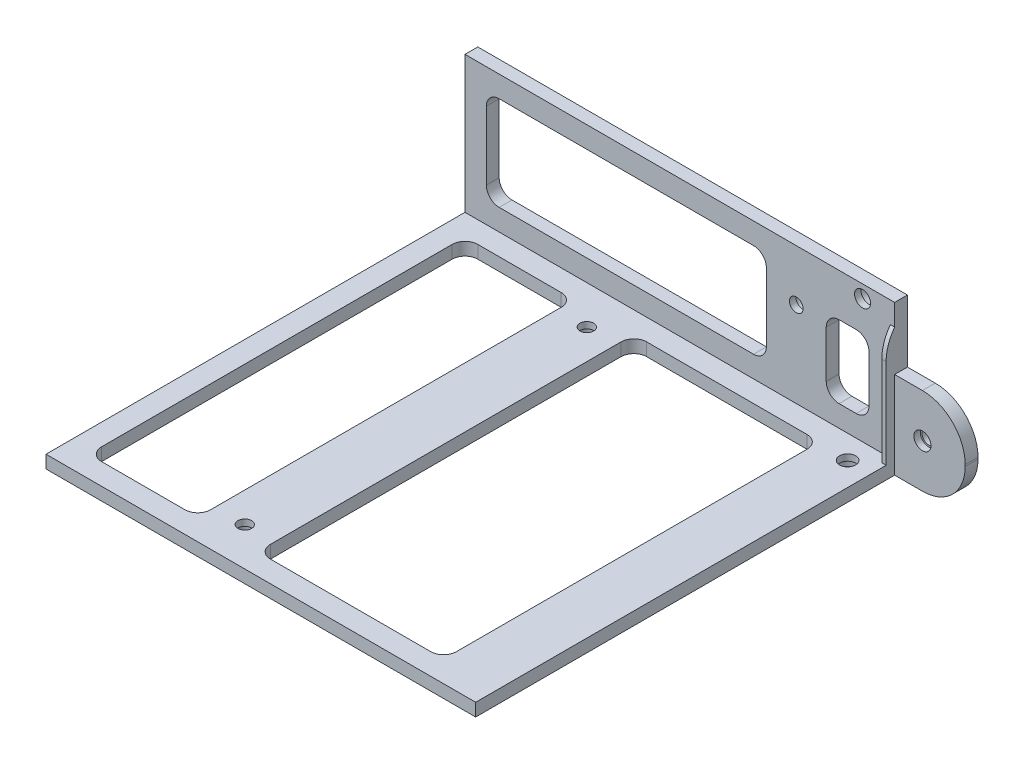
from build123d import *

# Parameters (mm, degrees)
SKETCH1_R           = 1.6
SKETCH1_R_2         = 1.875
BOSS_EXTRUDE1_DEPTH = 3
BOSS_EXTRUDE2_DEPTH = 101
SKETCH1_5_W         = 1
SKETCH1_5_H         = 27
BOSS_EXTRUDE3_DEPTH = 5
SKETCH2_W           = 16.5
SKETCH2_H           = 14.6
CUT_EXTRUDE1_DEPTH  = 5
SKETCH3_W           = 16.5
SKETCH3_H           = 98
CUT_EXTRUDE2_DEPTH  = 5
FILLET1_R           = 10
FILLET2_R           = 10
SKETCH4_R           = 1.6
SKETCH4_R_2         = 1.875
CUT_EXTRUDE3_DEPTH  = 5
FILLET3_R           = 10
SKETCH5_R           = 2
SKETCH5_R_2         = 2.5
CUT_EXTRUDE4_DEPTH  = 1.5
SKETCH6_R           = 2
CUT_EXTRUDE5_DEPTH  = 1.5
SKETCH7_R           = 2
SKETCH7_R_2         = 2.25
CUT_EXTRUDE6_DEPTH  = 1.5
SKETCH8_W           = 25.5
SKETCH8_H           = 88
SKETCH8_W_2         = 43.5
CUT_EXTRUDE7_DEPTH  = 10
FILLET4_R           = 3
SKETCH9_W           = 65.5
SKETCH9_H           = 22
SKETCH9_W_2         = 10
SKETCH9_H_2         = 17
CUT_EXTRUDE8_DEPTH  = 10
FILLET5_R           = 3


with BuildPart() as part:
    # Sketch1 → Boss-Extrude1 (new body)
    # profile 1 of 2: a face of its own
    with BuildSketch(Plane.XY):
        Polygon((0, 3), (0, 0), (117, 0), (117, 3), (100.5, 3), (99.5, 3), align=None)
    # profile 2 of 2: a face of its own
    with BuildSketch(Plane.XY):
        Polygon((0, 35), (0, 3), (99.5, 3), (99.5, 30), (100.5, 30), (100.5, 3), (117, 3), (117, 35), align=None)
        with Locations((107, 10.2)):
            Circle(SKETCH1_R, mode=Mode.SUBTRACT)
        with Locations((77.5, 23)):
            Circle(SKETCH1_R, mode=Mode.SUBTRACT)
        with Locations((93, 32)):
            Circle(SKETCH1_R_2, mode=Mode.SUBTRACT)
    extrude(amount=BOSS_EXTRUDE1_DEPTH)

    # Sketch1<4> → Boss-Extrude2 (add)
    with BuildSketch(Plane.XY):
        Polygon((0, 3), (0, 0), (117, 0), (117, 3), (100.5, 3), (99.5, 3), align=None)
    extrude(amount=BOSS_EXTRUDE2_DEPTH)

    # Sketch1<5> → Boss-Extrude3 (add)
    with BuildSketch(Plane.XY):
        with Locations((100, 16.5)):
            Rectangle(SKETCH1_5_W, SKETCH1_5_H)
    extrude(amount=BOSS_EXTRUDE3_DEPTH)

    # Sketch2 → Cut-Extrude1 (cut)
    with BuildSketch(Plane.XY.offset(3)):
        with Locations((108.75, 27.7)):
            Rectangle(SKETCH2_W, SKETCH2_H)
    extrude(amount=-CUT_EXTRUDE1_DEPTH, mode=Mode.SUBTRACT)

    # Sketch3 → Cut-Extrude2 (cut)
    with BuildSketch(Plane(origin=(0, 3, 0), x_dir=(1, 0, 0), z_dir=(0, 1, 0))):
        with Locations((108.75, -52)):
            Rectangle(SKETCH3_W, SKETCH3_H)
    extrude(amount=-CUT_EXTRUDE2_DEPTH, mode=Mode.SUBTRACT)

    # Fillet1
    fillet1_edges = [part.edges().sort_by_distance(p)[0] for p in [
        (117, 20.4, 1.5),
    ]]
    fillet(fillet1_edges, radius=FILLET1_R)

    # Fillet2
    fillet2_edges = [part.edges().sort_by_distance(p)[0] for p in [
        (117, 0, 1.5),
    ]]
    fillet(fillet2_edges, radius=FILLET2_R)

    # Sketch4 → Cut-Extrude3 (cut)
    with BuildSketch(Plane(origin=(0, 3, 0), x_dir=(1, 0, 0), z_dir=(0, 1, 0))):
        with Locations(Location((37.5, -12, 0), (0, 0, 270))):
            Circle(SKETCH4_R)
        with Locations(Location((37.5, -92, 0), (0, 0, 270))):
            Circle(SKETCH4_R)
        with Locations(Location((95, -8.5, 0), (0, 0, 270))):
            Circle(SKETCH4_R_2)
    extrude(amount=-CUT_EXTRUDE3_DEPTH, mode=Mode.SUBTRACT)

    # Fillet3
    # the kernel refuses this fillet: 10 mm, written as the material it takes off along each edge
    with BuildSketch(Plane(origin=(84.5, 30, 5), x_dir=(0, 0, -1), z_dir=(1, 0, 0))) as fillet3_piece_1:
        with BuildLine():
            CenterArc((10, -6), FILLET3_R, 143.130102354, 36.869897646)
            Line((0, -6), (-0.2, -6))
            Line((-0.2, -6), (-0.2, 0))
            Line((-0.2, 0), (0, 0.2))
            ThreePointArc((0, 0.2), (1, 0.2), (1.84, 0.12))
            Line((1.84, 0.12), (2, 0))
        make_face()
    extrude(amount=31, mode=Mode.SUBTRACT)

    # Sketch5 → Cut-Extrude4 (cut)
    with BuildSketch(Plane.XZ):
        with Locations(Location((37.5, 92, 0), (0, 0, 270))):
            Circle(SKETCH5_R)
        with Locations(Location((37.5, 12, 0), (0, 0, 270))):
            Circle(SKETCH5_R)
        with Locations(Location((95, 8.5, 0), (0, 0, 270))):
            Circle(SKETCH5_R_2)
    extrude(amount=-CUT_EXTRUDE4_DEPTH, mode=Mode.SUBTRACT)

    # Sketch6 → Cut-Extrude5 (cut)
    with BuildSketch(Plane.XY.offset(3)):
        with Locations((107, 10.2)):
            Circle(SKETCH6_R)
    extrude(amount=-CUT_EXTRUDE5_DEPTH, mode=Mode.SUBTRACT)

    # Sketch7 → Cut-Extrude6 (cut)
    with BuildSketch(Plane(origin=(0, 0, 0), x_dir=(-1, 0, 0), z_dir=(0, 0, -1))):
        with Locations((-77.5, 23)):
            Circle(SKETCH7_R)
        with Locations((-93, 32)):
            Circle(SKETCH7_R_2)
    extrude(amount=-CUT_EXTRUDE6_DEPTH, mode=Mode.SUBTRACT)

    # Sketch8 → Cut-Extrude7 (cut)
    with BuildSketch(Plane(origin=(0, 3, 0), x_dir=(1, 0, 0), z_dir=(0, 1, 0))):
        with Locations((17.75, -52)):
            Rectangle(SKETCH8_W, SKETCH8_H)
        with Locations((66.25, -52)):
            Rectangle(SKETCH8_W_2, SKETCH8_H)
    extrude(amount=-CUT_EXTRUDE7_DEPTH, mode=Mode.SUBTRACT)

    # Fillet4
    fillet4_edges = [part.edges().sort_by_distance(p)[0] for p in [
        (5, 1.5, 96),
        (5, 1.5, 8),
        (30.5, 1.5, 8),
        (30.5, 1.5, 96),
        (44.5, 1.5, 96),
        (44.5, 1.5, 8),
        (88, 1.5, 8),
        (88, 1.5, 96),
    ]]
    fillet(fillet4_edges, radius=FILLET4_R)

    # Sketch9 → Cut-Extrude8 (cut)
    with BuildSketch(Plane.XY.offset(3)):
        with Locations((37.75, 19)):
            Rectangle(SKETCH9_W, SKETCH9_H)
        with Locations((89.5, 16.5)):
            Rectangle(SKETCH9_W_2, SKETCH9_H_2)
    extrude(amount=-CUT_EXTRUDE8_DEPTH, mode=Mode.SUBTRACT)

    # Fillet5
    fillet5_edges = [part.edges().sort_by_distance(p)[0] for p in [
        (5, 8, 1.5),
        (5, 30, 1.5),
        (70.5, 30, 1.5),
        (70.5, 8, 1.5),
        (84.5, 8, 1.5),
        (84.5, 25, 1.5),
        (94.5, 25, 1.5),
        (94.5, 8, 1.5),
    ]]
    fillet(fillet5_edges, radius=FILLET5_R)


solid = part.part
